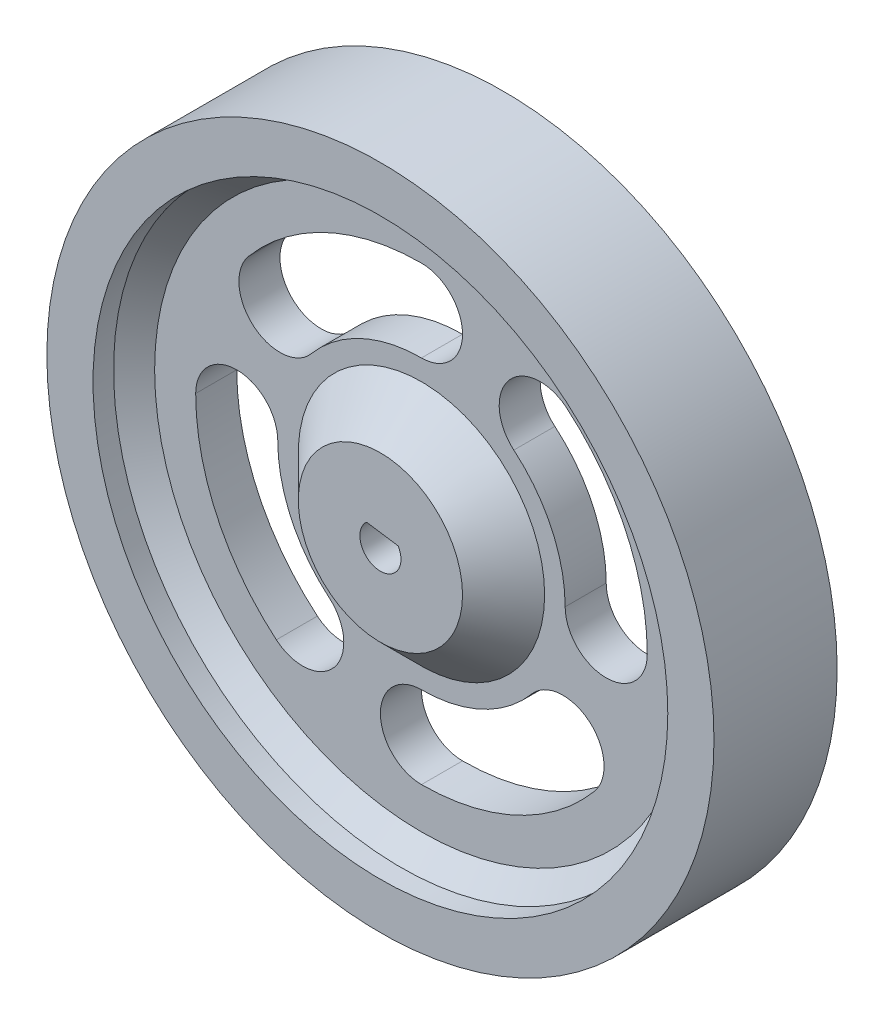
from build123d import *

# Parameters (mm, degrees)
ESQUISSE1_R                  = 32.5
BOSS_EXTRU_1_DEPTH           = 12
ESQUISSE2_R                  = 28
ESQUISSE2_R_2                = 8
ENL_V_MAT_EXTRU_1_DEPTH      = 4
CHANFREIN1_SIZE              = 4
CHANFREIN2_SIZE              = 2
CHANFREIN1_OF_SYM_TRIE1_SIZE = 4
CHANFREIN2_OF_SYM_TRIE1_SIZE = 2


with BuildPart() as part:
    # Esquisse1 → Boss.-Extru.1 (new body)
    with BuildSketch(Plane.XY):
        Circle(ESQUISSE1_R)
        with BuildLine():
            Line((-1.354529956, 1.471478372), (1.732143973, 0.999838616))
            ThreePointArc((1.732143973, 0.999838616), (-0.302091213, -1.97705359), (-1.354529956, 1.471478372))
        make_face(mode=Mode.SUBTRACT)
        with BuildLine():
            ThreePointArc((-10.724622204, 8.999026536), (-5.916655664, 12.688309019), (0, 14))
            ThreePointArc((0, 14), (4, 18), (0, 22))
            ThreePointArc((0, 22), (-9.297601758, 19.938771315), (-16.852977749, 14.141327413))
            ThreePointArc((-16.852977749, 14.141327413), (-16.359950415, 8.505999202), (-10.724622204, 8.999026536))
        make_face(mode=Mode.SUBTRACT)
        with BuildLine():
            ThreePointArc((22, 0), (19.938771315, 9.297601758), (14.141327413, 16.852977749))
            ThreePointArc((14.141327413, 16.852977749), (8.505999202, 16.359950415), (8.999026536, 10.724622204))
            ThreePointArc((8.999026536, 10.724622204), (12.688309019, 5.916655664), (14, 0))
            ThreePointArc((14, 0), (18, -4), (22, 0))
        make_face(mode=Mode.SUBTRACT)
        with BuildLine():
            ThreePointArc((0, -22), (9.297601758, -19.938771315), (16.852977749, -14.141327413))
            ThreePointArc((16.852977749, -14.141327413), (16.359950415, -8.505999202), (10.724622204, -8.999026536))
            ThreePointArc((10.724622204, -8.999026536), (5.916655664, -12.688309019), (0, -14))
            ThreePointArc((0, -14), (-4, -18), (0, -22))
        make_face(mode=Mode.SUBTRACT)
        with BuildLine():
            ThreePointArc((-22, 0), (-19.938771315, -9.297601758), (-14.141327413, -16.852977749))
            ThreePointArc((-14.141327413, -16.852977749), (-8.505999202, -16.359950415), (-8.999026536, -10.724622204))
            ThreePointArc((-8.999026536, -10.724622204), (-12.688309019, -5.916655664), (-14, 0))
            ThreePointArc((-14, 0), (-18, 4), (-22, 0))
        make_face(mode=Mode.SUBTRACT)
    extrude(amount=BOSS_EXTRU_1_DEPTH)

    # Esquisse2 → Enlèv. mat.-Extru.1 (cut)
    with BuildSketch(Plane.XY.offset(12)):
        Circle(ESQUISSE2_R)
        Circle(ESQUISSE2_R_2, mode=Mode.SUBTRACT)
    enl_v_mat_extru_1 = extrude(amount=-ENL_V_MAT_EXTRU_1_DEPTH, mode=Mode.SUBTRACT)

    # Chanfrein1
    chanfrein1_edges = [part.edges().sort_by_distance(p)[0] for p in [
        (-8, 0, 8),
    ]]
    chamfer(chanfrein1_edges, length=CHANFREIN1_SIZE - 0.0001)  # a hair under: the kernel refuses the full size

    # Chanfrein2
    chanfrein2_edges = [part.edges().sort_by_distance(p)[0] for p in [
        (-28, 0, 8),
    ]]
    chamfer(chanfrein2_edges, length=CHANFREIN2_SIZE)

    # Symétrie1: Enlèv. mat.-Extru.1 across plane
    add(enl_v_mat_extru_1.mirror(Plane.XY.offset(6)), mode=Mode.SUBTRACT)

    # Chanfrein1 of Symétrie1
    chanfrein1_of_sym_trie1_edges = [part.edges().sort_by_distance(p)[0] for p in [
        (-8, 0, 4),
    ]]
    chamfer(chanfrein1_of_sym_trie1_edges, length=CHANFREIN1_OF_SYM_TRIE1_SIZE - 0.0001)  # a hair under: the kernel refuses the full size

    # Chanfrein2 of Symétrie1
    chanfrein2_of_sym_trie1_edges = [part.edges().sort_by_distance(p)[0] for p in [
        (-28, 0, 4),
    ]]
    chamfer(chanfrein2_of_sym_trie1_edges, length=CHANFREIN2_OF_SYM_TRIE1_SIZE)


solid = part.part
